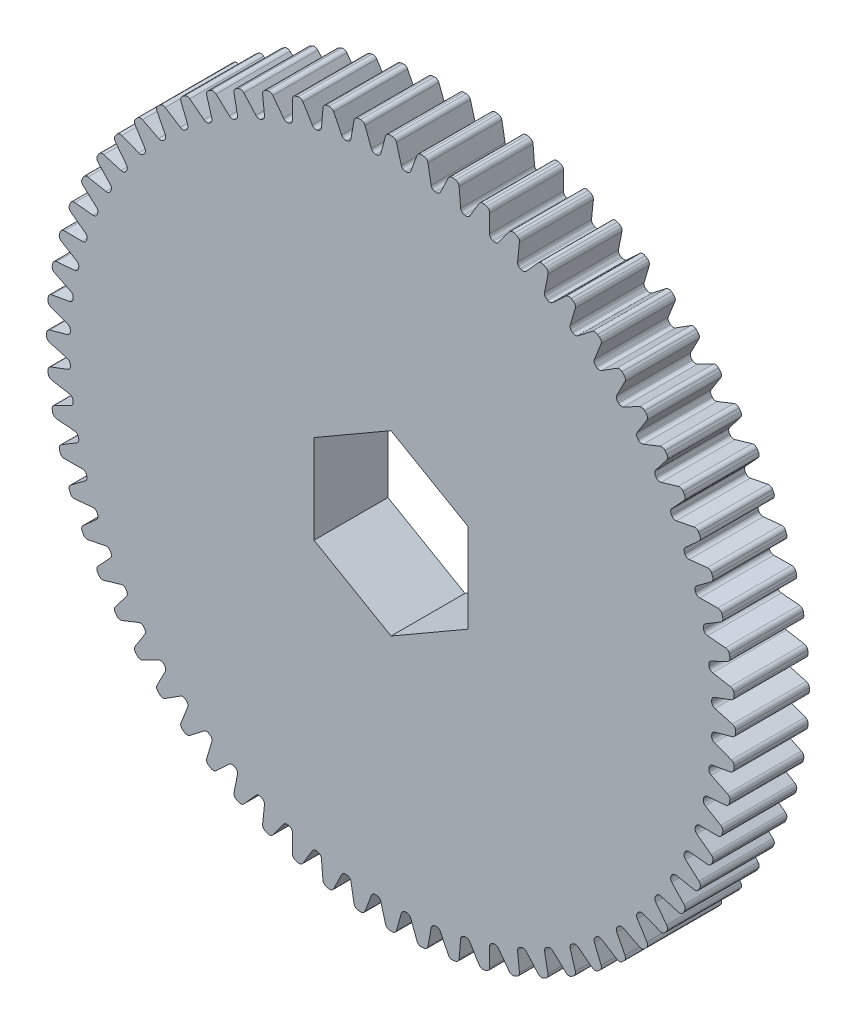
from build123d import *

# Parameters (mm, degrees)
SKETCH2_R           = 26.05
BOSS_EXTRUDE1_DEPTH = 6
BOSS_EXTRUDE2_DEPTH = 6
FILLET1_R           = 0.35
CIRPATTERN2_DEPTH   = 6
CUT_EXTRUDE1_DEPTH  = 40.980057529


# Read off the part's stored shape, not the designer's step: CirPattern2
with BuildPart() as part:
    # Sketch2 → Boss-Extrude1 (new body)
    with BuildSketch(Plane.XY):
        Circle(SKETCH2_R)
    extrude(amount=BOSS_EXTRUDE1_DEPTH)

    # Sketch3 → Boss-Extrude2 (add)
    with BuildSketch(Plane.XY):
        with BuildLine():
            Line((-0.375, 27.947484234), (-0.9, 26.034448333))
            ThreePointArc((-0.9, 26.034448333), (0, 26.05), (0.9, 26.034448333))
            Line((0.9, 26.034448333), (0.375, 27.947484234))
            ThreePointArc((0.375, 27.947484234), (0, 27.95), (-0.375, 27.947484234))
        make_face()
    extrude(amount=BOSS_EXTRUDE2_DEPTH)

    # Fillet1
    fillet1_edges = [part.edges().sort_by_distance(p)[0] for p in [
        (0.375, 27.947484234, 3),
        (-0.375, 27.947484234, 3),
        (-0.9, 26.034448333, 3),
        (0.9, 26.034448333, 3),
    ]]
    fillet(fillet1_edges, radius=FILLET1_R)

    # CirPattern2 outline → CirPattern2 (add)
    with BuildSketch(Plane.XY):
        with BuildLine():
            ThreePointArc((-3.253611534, 26.092546808), (-3.355588666, 25.901404355), (-3.550535103, 25.806902187))
            ThreePointArc((-3.550535103, 25.806902187), (-2.403590764, 25.938875293), (-1.251925338, 26.019899749))
            ThreePointArc((-1.251925338, 26.019899749), (-1.460917168, 26.076971525), (-1.59628028, 26.246121165))
            Line((-1.59628028, 26.246121165), (-2.112033528, 27.615345868))
            ThreePointArc((-2.112033528, 27.615345868), (-2.253348658, 27.788320087), (-2.470504527, 27.840601778))
            ThreePointArc((-2.470504527, 27.840601778), (-2.578900647, 27.830770227), (-2.687257659, 27.820516643))
            ThreePointArc((-2.687257659, 27.820516643), (-2.891109301, 27.729222861), (-2.998234344, 27.533227269))
            Line((-2.998234344, 27.533227269), (-3.253611534, 26.092546808))
        make_face()
        with BuildLine():
            ThreePointArc((-5.647248689, 25.681035205), (-5.731154404, 25.481298869), (-5.916549674, 25.369212443))
            ThreePointArc((-5.916549674, 25.369212443), (-4.786674939, 25.606449247), (-3.647398308, 25.793390347))
            ThreePointArc((-3.647398308, 25.793390347), (-3.860764536, 25.830935331), (-4.011157372, 25.986873677))
            Line((-4.011157372, 25.986873677), (-4.651046625, 27.302669803))
            ThreePointArc((-4.651046625, 27.302669803), (-4.807718977, 27.461867229), (-5.028772443, 27.49388928))
            ThreePointArc((-5.028772443, 27.49388928), (-5.135799023, 27.474098136), (-5.242747722, 27.453890368))
            ThreePointArc((-5.242747722, 27.453890368), (-5.437306241, 27.344176973), (-5.525890116, 27.139133212))
            Line((-5.525890116, 27.139133212), (-5.647248689, 25.681035205))
        make_face()
        with BuildLine():
            ThreePointArc((-7.992705509, 25.050422064), (-8.057823954, 24.843795926), (-8.232086329, 24.715081523))
            ThreePointArc((-8.232086329, 24.715081523), (-7.128920891, 25.055558005), (-6.011752962, 25.346820833))
            ThreePointArc((-6.011752962, 25.346820833), (-6.227673221, 25.364518705), (-6.391812684, 25.505915345))
            Line((-6.391812684, 25.505915345), (-7.150378632, 26.757056985))
            ThreePointArc((-7.150378632, 26.757056985), (-7.321071533, 26.901119402), (-7.544136646, 26.912608611))
            ThreePointArc((-7.544136646, 26.912608611), (-7.648880573, 26.883026727), (-7.75350851, 26.85303718))
            ThreePointArc((-7.75350851, 26.85303718), (-7.937114002, 26.725840207), (-8.006400941, 26.513497638))
            Line((-8.006400941, 26.513497638), (-7.992705509, 25.050422064))
        make_face()
        with BuildLine():
            ThreePointArc((-10.269971384, 24.206087555), (-10.31574699, 23.994334475), (-10.477389726, 23.850090242))
            ThreePointArc((-10.477389726, 23.850090242), (-9.410345404, 24.290901576), (-8.32481746, 24.68400118))
            ThreePointArc((-8.32481746, 24.68400118), (-8.541449595, 24.681700948), (-8.717935303, 24.807349536))
            Line((-8.717935303, 24.807349536), (-9.588706129, 25.983162391))
            ThreePointArc((-9.588706129, 25.983162391), (-9.771963287, 26.110860709), (-9.995136934, 26.101719056))
            ThreePointArc((-9.995136934, 26.101719056), (-10.09670457, 26.062598812), (-10.198119096, 26.023083347))
            ThreePointArc((-10.198119096, 26.023083347), (-10.369205104, 25.879487997), (-10.418603977, 25.661658252))
            Line((-10.418603977, 25.661658252), (-10.269971384, 24.206087555))
        make_face()
        with BuildLine():
            ThreePointArc((-12.459617484, 23.155235242), (-12.485659711, 22.940161823), (-12.633303728, 22.7816184))
            ThreePointArc((-12.633303728, 22.7816184), (-11.611484168, 23.31900374), (-10.56685755, 23.810586333))
            ThreePointArc((-10.56685755, 23.810586333), (-10.782353332, 23.788307622), (-10.969679572, 23.897136168))
            Line((-10.969679572, 23.897136168), (-11.945226166, 24.987588617))
            ThreePointArc((-11.945226166, 24.987588617), (-12.139484096, 25.09783336), (-12.360862239, 25.068138836))
            ThreePointArc((-12.360862239, 25.068138836), (-12.458387044, 25.019813993), (-12.555722927, 24.971109743))
            ThreePointArc((-12.555722927, 24.971109743), (-12.712829804, 24.81234112), (-12.741919157, 24.590882645))
            Line((-12.741919157, 24.590882645), (-12.459617484, 23.155235242))
        make_face()
        with BuildLine():
            ThreePointArc((-14.542962521, 21.906830625), (-14.549049185, 21.690271798), (-14.681434837, 21.518781822))
            ThreePointArc((-14.681434837, 21.518781822), (-13.713557843, 22.148156386), (-12.718744937, 22.734027959))
            ThreePointArc((-12.718744937, 22.734027959), (-12.931265832, 22.691960842), (-13.127834403, 22.78304086))
            Line((-13.127834403, 22.78304086), (-14.199833746, 23.778829547))
            ThreePointArc((-14.199833746, 23.778829547), (-14.403435107, 23.870680145), (-14.621129025, 23.820686095))
            ThreePointArc((-14.621129025, 23.820686095), (-14.713778952, 23.763568944), (-14.806205756, 23.706091435))
            ThreePointArc((-14.806205756, 23.706091435), (-14.947993123, 23.533504097), (-14.956524776, 23.310306298))
            Line((-14.956524776, 23.310306298), (-14.542962521, 21.906830625))
        make_face()
        with BuildLine():
            ThreePointArc((-16.50223213, 20.471524654), (-16.488311301, 20.255328023), (-16.604309121, 20.072354586))
            ThreePointArc((-16.604309121, 20.072354586), (-15.698632278, 20.788348771), (-14.762120477, 21.463510873))
            ThreePointArc((-14.762120477, 21.463510873), (-14.969853331, 21.402014254), (-15.17398718, 21.47456868))
            Line((-15.17398718, 21.47456868), (-16.333293351, 22.367197888))
            ThreePointArc((-16.333293351, 22.367197888), (-16.544501089, 22.439870704), (-16.756653493, 22.370003659))
            ThreePointArc((-16.756653493, 22.370003659), (-16.843638087, 22.304581502), (-16.930367259, 22.238821113))
            ThreePointArc((-16.930367259, 22.238821113), (-17.055625435, 22.053887514), (-17.043526598, 21.830854636))
            Line((-17.043526598, 21.830854636), (-16.50223213, 20.471524654))
        make_face()
        with BuildLine():
            ThreePointArc((-18.320710513, 18.861562853), (-18.286900959, 18.64757293), (-18.385521294, 18.454677097))
            ThreePointArc((-18.385521294, 18.454677097), (-17.549771517, 19.251182294), (-16.67955081, 20.009874681))
            ThreePointArc((-16.67955081, 20.009874681), (-16.88072332, 19.929473225), (-17.090680848, 19.982883053))
            Line((-17.090680848, 19.982883053), (-18.327403056, 20.764737183))
            ThreePointArc((-18.327403056, 20.764737183), (-18.54441522, 20.817612198), (-18.749216102, 20.728468239))
            ThreePointArc((-18.749216102, 20.728468239), (-18.82979324, 20.655299236), (-18.910084837, 20.58181701))
            ThreePointArc((-18.910084837, 20.58181701), (-19.017745164, 20.386114939), (-18.985119062, 20.16514982))
            Line((-18.985119062, 20.16514982), (-18.320710513, 18.861562853))
        make_face()
        with BuildLine():
            ThreePointArc((-19.982883053, 17.090680848), (-19.929473225, 16.88072332), (-20.009874681, 16.67955081))
            ThreePointArc((-20.009874681, 16.67955081), (-19.251182294, 17.549771517), (-18.454677097, 18.385521294))
            ThreePointArc((-18.454677097, 18.385521294), (-18.64757293, 18.286900959), (-18.861562853, 18.320710513))
            Line((-18.861562853, 18.320710513), (-20.16514982, 18.985119062))
            ThreePointArc((-20.16514982, 18.985119062), (-20.386114939, 19.017745164), (-20.58181701, 18.910084837))
            ThreePointArc((-20.58181701, 18.910084837), (-20.655299236, 18.82979324), (-20.728468239, 18.749216102))
            ThreePointArc((-20.728468239, 18.749216102), (-20.817612198, 18.54441522), (-20.764737183, 18.327403056))
            Line((-20.764737183, 18.327403056), (-19.982883053, 17.090680848))
        make_face()
        with BuildLine():
            ThreePointArc((-21.47456868, 15.17398718), (-21.402014254, 14.969853331), (-21.463510873, 14.762120477))
            ThreePointArc((-21.463510873, 14.762120477), (-20.788348771, 15.698632278), (-20.072354586, 16.604309121))
            ThreePointArc((-20.072354586, 16.604309121), (-20.255328023, 16.488311301), (-20.471524654, 16.50223213))
            Line((-20.471524654, 16.50223213), (-21.830854636, 17.043526598))
            ThreePointArc((-21.830854636, 17.043526598), (-22.053887514, 17.055625435), (-22.238821113, 16.930367259))
            ThreePointArc((-22.238821113, 16.930367259), (-22.304581502, 16.843638087), (-22.370003659, 16.756653493))
            ThreePointArc((-22.370003659, 16.756653493), (-22.439870704, 16.544501089), (-22.367197888, 16.333293351))
            Line((-22.367197888, 16.333293351), (-21.47456868, 15.17398718))
        make_face()
        with BuildLine():
            ThreePointArc((-22.78304086, 13.127834403), (-22.691960842, 12.931265832), (-22.734027959, 12.718744937))
            ThreePointArc((-22.734027959, 12.718744937), (-22.148156386, 13.713557843), (-21.518781822, 14.681434837))
            ThreePointArc((-21.518781822, 14.681434837), (-21.690271798, 14.549049185), (-21.906830625, 14.542962521))
            Line((-21.906830625, 14.542962521), (-23.310306298, 14.956524776))
            ThreePointArc((-23.310306298, 14.956524776), (-23.533504097, 14.947993123), (-23.706091435, 14.806205756))
            ThreePointArc((-23.706091435, 14.806205756), (-23.763568944, 14.713778952), (-23.820686095, 14.621129025))
            ThreePointArc((-23.820686095, 14.621129025), (-23.870680145, 14.403435107), (-23.778829547, 14.199833746))
            Line((-23.778829547, 14.199833746), (-22.78304086, 13.127834403))
        make_face()
        with BuildLine():
            ThreePointArc((-23.897136168, 10.969679572), (-23.788307622, 10.782353332), (-23.810586333, 10.56685755))
            ThreePointArc((-23.810586333, 10.56685755), (-23.31900374, 11.611484168), (-22.7816184, 12.633303728))
            ThreePointArc((-22.7816184, 12.633303728), (-22.940161823, 12.485659711), (-23.155235242, 12.459617484))
            Line((-23.155235242, 12.459617484), (-24.590882645, 12.741919157))
            ThreePointArc((-24.590882645, 12.741919157), (-24.81234112, 12.712829804), (-24.971109743, 12.555722927))
            ThreePointArc((-24.971109743, 12.555722927), (-25.019813993, 12.458387044), (-25.068138836, 12.360862239))
            ThreePointArc((-25.068138836, 12.360862239), (-25.09783336, 12.139484096), (-24.987588617, 11.945226166))
            Line((-24.987588617, 11.945226166), (-23.897136168, 10.969679572))
        make_face()
        with BuildLine():
            ThreePointArc((-24.807349536, 8.717935303), (-24.681700948, 8.541449595), (-24.68400118, 8.32481746))
            ThreePointArc((-24.68400118, 8.32481746), (-24.290901576, 9.410345404), (-23.850090242, 10.477389726))
            ThreePointArc((-23.850090242, 10.477389726), (-23.994334475, 10.31574699), (-24.206087555, 10.269971384))
            Line((-24.206087555, 10.269971384), (-25.661658252, 10.418603977))
            ThreePointArc((-25.661658252, 10.418603977), (-25.879487997, 10.369205104), (-26.023083347, 10.198119096))
            ThreePointArc((-26.023083347, 10.198119096), (-26.062598812, 10.09670457), (-26.101719056, 9.995136934))
            ThreePointArc((-26.101719056, 9.995136934), (-26.110860709, 9.771963287), (-25.983162391, 9.588706129))
            Line((-25.983162391, 9.588706129), (-24.807349536, 8.717935303))
        make_face()
        with BuildLine():
            ThreePointArc((-25.505915345, 6.391812684), (-25.364518705, 6.227673221), (-25.346820833, 6.011752962))
            ThreePointArc((-25.346820833, 6.011752962), (-25.055558005, 7.128920891), (-24.715081523, 8.232086329))
            ThreePointArc((-24.715081523, 8.232086329), (-24.843795926, 8.057823954), (-25.050422064, 7.992705509))
            Line((-25.050422064, 7.992705509), (-26.513497638, 8.006400941))
            ThreePointArc((-26.513497638, 8.006400941), (-26.725840207, 7.937114002), (-26.85303718, 7.75350851))
            ThreePointArc((-26.85303718, 7.75350851), (-26.883026727, 7.648880573), (-26.912608611, 7.544136646))
            ThreePointArc((-26.912608611, 7.544136646), (-26.901119402, 7.321071533), (-26.757056985, 7.150378632))
            Line((-26.757056985, 7.150378632), (-25.505915345, 6.391812684))
        make_face()
        with BuildLine():
            ThreePointArc((-25.986873677, 4.011157372), (-25.830935331, 3.860764536), (-25.793390347, 3.647398308))
            ThreePointArc((-25.793390347, 3.647398308), (-25.606449247, 4.786674939), (-25.369212443, 5.916549674))
            ThreePointArc((-25.369212443, 5.916549674), (-25.481298869, 5.731154404), (-25.681035205, 5.647248689))
            Line((-25.681035205, 5.647248689), (-27.139133212, 5.525890116))
            ThreePointArc((-27.139133212, 5.525890116), (-27.344176973, 5.437306241), (-27.453890368, 5.242747722))
            ThreePointArc((-27.453890368, 5.242747722), (-27.474098136, 5.135799023), (-27.49388928, 5.028772443))
            ThreePointArc((-27.49388928, 5.028772443), (-27.461867229, 4.807718977), (-27.302669803, 4.651046625))
            Line((-27.302669803, 4.651046625), (-25.986873677, 4.011157372))
        make_face()
        with BuildLine():
            ThreePointArc((-26.246121165, 1.59628028), (-26.076971525, 1.460917168), (-26.019899749, 1.251925338))
            ThreePointArc((-26.019899749, 1.251925338), (-25.938875293, 2.403590764), (-25.806902187, 3.550535103))
            ThreePointArc((-25.806902187, 3.550535103), (-25.901404355, 3.355588666), (-26.092546808, 3.253611534))
            Line((-26.092546808, 3.253611534), (-27.533227269, 2.998234344))
            ThreePointArc((-27.533227269, 2.998234344), (-27.729222861, 2.891109301), (-27.820516643, 2.687257659))
            ThreePointArc((-27.820516643, 2.687257659), (-27.830770227, 2.578900647), (-27.840601778, 2.470504527))
            ThreePointArc((-27.840601778, 2.470504527), (-27.788320087, 2.253348658), (-27.615345868, 2.112033528))
            Line((-27.615345868, 2.112033528), (-26.246121165, 1.59628028))
        make_face()
        with BuildLine():
            ThreePointArc((-26.281446002, -0.832215712), (-26.100528192, -0.951394229), (-26.024416541, -1.154228619))
            ThreePointArc((-26.024416541, -1.154228619), (-26.05, 0), (-26.024416541, 1.154228619))
            ThreePointArc((-26.024416541, 1.154228619), (-26.100528192, 0.951394229), (-26.281446002, 0.832215712))
            Line((-26.281446002, 0.832215712), (-27.69241754, 0.444998694))
            ThreePointArc((-27.69241754, 0.444998694), (-27.877692797, 0.320246436), (-27.949788079, 0.108840862))
            ThreePointArc((-27.949788079, 0.108840862), (-27.95, 0), (-27.949788079, -0.108840862))
            ThreePointArc((-27.949788079, -0.108840862), (-27.877692797, -0.320246436), (-27.69241754, -0.444998694))
            Line((-27.69241754, -0.444998694), (-26.281446002, -0.832215712))
        make_face()
        with BuildLine():
            ThreePointArc((-26.092546808, -3.253611534), (-25.901404355, -3.355588666), (-25.806902187, -3.550535103))
            ThreePointArc((-25.806902187, -3.550535103), (-25.938875292, -2.403590764), (-26.019899749, -1.251925338))
            ThreePointArc((-26.019899749, -1.251925338), (-26.076971525, -1.460917168), (-26.246121165, -1.59628028))
            Line((-26.246121165, -1.59628028), (-27.615345868, -2.112033528))
            ThreePointArc((-27.615345868, -2.112033528), (-27.788320087, -2.253348658), (-27.840601778, -2.470504527))
            ThreePointArc((-27.840601778, -2.470504527), (-27.830770227, -2.578900647), (-27.820516643, -2.687257659))
            ThreePointArc((-27.820516643, -2.687257659), (-27.729222861, -2.891109301), (-27.533227269, -2.998234344))
            Line((-27.533227269, -2.998234344), (-26.092546808, -3.253611534))
        make_face()
        with BuildLine():
            ThreePointArc((-25.681035205, -5.647248689), (-25.481298869, -5.731154404), (-25.369212443, -5.916549674))
            ThreePointArc((-25.369212443, -5.916549674), (-25.606449247, -4.786674939), (-25.793390347, -3.647398308))
            ThreePointArc((-25.793390347, -3.647398308), (-25.830935331, -3.860764536), (-25.986873677, -4.011157372))
            Line((-25.986873677, -4.011157372), (-27.302669803, -4.651046625))
            ThreePointArc((-27.302669803, -4.651046625), (-27.461867229, -4.807718977), (-27.49388928, -5.028772443))
            ThreePointArc((-27.49388928, -5.028772443), (-27.474098136, -5.135799023), (-27.453890368, -5.242747722))
            ThreePointArc((-27.453890368, -5.242747722), (-27.344176973, -5.437306241), (-27.139133212, -5.525890116))
            Line((-27.139133212, -5.525890116), (-25.681035205, -5.647248689))
        make_face()
        with BuildLine():
            ThreePointArc((-25.050422064, -7.992705509), (-24.843795926, -8.057823954), (-24.715081523, -8.232086329))
            ThreePointArc((-24.715081523, -8.232086329), (-25.055558005, -7.128920891), (-25.346820833, -6.011752962))
            ThreePointArc((-25.346820833, -6.011752962), (-25.364518705, -6.227673221), (-25.505915345, -6.391812684))
            Line((-25.505915345, -6.391812684), (-26.757056985, -7.150378632))
            ThreePointArc((-26.757056985, -7.150378632), (-26.901119402, -7.321071533), (-26.912608611, -7.544136646))
            ThreePointArc((-26.912608611, -7.544136646), (-26.883026727, -7.648880573), (-26.85303718, -7.75350851))
            ThreePointArc((-26.85303718, -7.75350851), (-26.725840207, -7.937114002), (-26.513497638, -8.006400941))
            Line((-26.513497638, -8.006400941), (-25.050422064, -7.992705509))
        make_face()
        with BuildLine():
            ThreePointArc((-24.206087555, -10.269971384), (-23.994334475, -10.31574699), (-23.850090242, -10.477389726))
            ThreePointArc((-23.850090242, -10.477389726), (-24.290901576, -9.410345404), (-24.68400118, -8.32481746))
            ThreePointArc((-24.68400118, -8.32481746), (-24.681700948, -8.541449595), (-24.807349536, -8.717935303))
            Line((-24.807349536, -8.717935303), (-25.983162391, -9.588706129))
            ThreePointArc((-25.983162391, -9.588706129), (-26.110860709, -9.771963287), (-26.101719056, -9.995136934))
            ThreePointArc((-26.101719056, -9.995136934), (-26.062598812, -10.09670457), (-26.023083347, -10.198119096))
            ThreePointArc((-26.023083347, -10.198119096), (-25.879487997, -10.369205104), (-25.661658252, -10.418603977))
            Line((-25.661658252, -10.418603977), (-24.206087555, -10.269971384))
        make_face()
        with BuildLine():
            ThreePointArc((-23.155235242, -12.459617484), (-22.940161823, -12.485659711), (-22.7816184, -12.633303728))
            ThreePointArc((-22.7816184, -12.633303728), (-23.31900374, -11.611484168), (-23.810586333, -10.56685755))
            ThreePointArc((-23.810586333, -10.56685755), (-23.788307622, -10.782353332), (-23.897136168, -10.969679572))
            Line((-23.897136168, -10.969679572), (-24.987588617, -11.945226166))
            ThreePointArc((-24.987588617, -11.945226166), (-25.09783336, -12.139484096), (-25.068138836, -12.360862239))
            ThreePointArc((-25.068138836, -12.360862239), (-25.019813993, -12.458387044), (-24.971109743, -12.555722927))
            ThreePointArc((-24.971109743, -12.555722927), (-24.81234112, -12.712829804), (-24.590882645, -12.741919157))
            Line((-24.590882645, -12.741919157), (-23.155235242, -12.459617484))
        make_face()
        with BuildLine():
            ThreePointArc((-21.906830625, -14.542962521), (-21.690271798, -14.549049185), (-21.518781822, -14.681434837))
            ThreePointArc((-21.518781822, -14.681434837), (-22.148156386, -13.713557843), (-22.734027959, -12.718744937))
            ThreePointArc((-22.734027959, -12.718744937), (-22.691960842, -12.931265832), (-22.78304086, -13.127834403))
            Line((-22.78304086, -13.127834403), (-23.778829547, -14.199833746))
            ThreePointArc((-23.778829547, -14.199833746), (-23.870680145, -14.403435107), (-23.820686095, -14.621129025))
            ThreePointArc((-23.820686095, -14.621129025), (-23.763568944, -14.713778952), (-23.706091435, -14.806205756))
            ThreePointArc((-23.706091435, -14.806205756), (-23.533504097, -14.947993123), (-23.310306298, -14.956524776))
            Line((-23.310306298, -14.956524776), (-21.906830625, -14.542962521))
        make_face()
        with BuildLine():
            ThreePointArc((-20.471524654, -16.50223213), (-20.255328023, -16.488311301), (-20.072354586, -16.604309121))
            ThreePointArc((-20.072354586, -16.604309121), (-20.788348771, -15.698632278), (-21.463510873, -14.762120477))
            ThreePointArc((-21.463510873, -14.762120477), (-21.402014254, -14.969853331), (-21.47456868, -15.17398718))
            Line((-21.47456868, -15.17398718), (-22.367197888, -16.333293351))
            ThreePointArc((-22.367197888, -16.333293351), (-22.439870704, -16.544501089), (-22.370003659, -16.756653493))
            ThreePointArc((-22.370003659, -16.756653493), (-22.304581502, -16.843638087), (-22.238821113, -16.930367259))
            ThreePointArc((-22.238821113, -16.930367259), (-22.053887514, -17.055625435), (-21.830854636, -17.043526598))
            Line((-21.830854636, -17.043526598), (-20.471524654, -16.50223213))
        make_face()
        with BuildLine():
            ThreePointArc((-18.861562853, -18.320710513), (-18.64757293, -18.286900959), (-18.454677097, -18.385521294))
            ThreePointArc((-18.454677097, -18.385521294), (-19.251182294, -17.549771517), (-20.009874681, -16.67955081))
            ThreePointArc((-20.009874681, -16.67955081), (-19.929473225, -16.88072332), (-19.982883053, -17.090680848))
            Line((-19.982883053, -17.090680848), (-20.764737183, -18.327403056))
            ThreePointArc((-20.764737183, -18.327403056), (-20.817612198, -18.54441522), (-20.728468239, -18.749216102))
            ThreePointArc((-20.728468239, -18.749216102), (-20.655299236, -18.82979324), (-20.58181701, -18.910084837))
            ThreePointArc((-20.58181701, -18.910084837), (-20.386114939, -19.017745164), (-20.16514982, -18.985119062))
            Line((-20.16514982, -18.985119062), (-18.861562853, -18.320710513))
        make_face()
        with BuildLine():
            ThreePointArc((-17.090680848, -19.982883053), (-16.88072332, -19.929473225), (-16.67955081, -20.009874681))
            ThreePointArc((-16.67955081, -20.009874681), (-17.549771517, -19.251182294), (-18.385521294, -18.454677097))
            ThreePointArc((-18.385521294, -18.454677097), (-18.286900959, -18.64757293), (-18.320710513, -18.861562853))
            Line((-18.320710513, -18.861562853), (-18.985119062, -20.16514982))
            ThreePointArc((-18.985119062, -20.16514982), (-19.017745164, -20.386114939), (-18.910084837, -20.58181701))
            ThreePointArc((-18.910084837, -20.58181701), (-18.82979324, -20.655299236), (-18.749216102, -20.728468239))
            ThreePointArc((-18.749216102, -20.728468239), (-18.54441522, -20.817612198), (-18.327403056, -20.764737183))
            Line((-18.327403056, -20.764737183), (-17.090680848, -19.982883053))
        make_face()
        with BuildLine():
            ThreePointArc((-15.17398718, -21.47456868), (-14.969853331, -21.402014254), (-14.762120477, -21.463510873))
            ThreePointArc((-14.762120477, -21.463510873), (-15.698632278, -20.788348771), (-16.604309121, -20.072354586))
            ThreePointArc((-16.604309121, -20.072354586), (-16.488311301, -20.255328023), (-16.50223213, -20.471524654))
            Line((-16.50223213, -20.471524654), (-17.043526598, -21.830854636))
            ThreePointArc((-17.043526598, -21.830854636), (-17.055625435, -22.053887514), (-16.930367259, -22.238821113))
            ThreePointArc((-16.930367259, -22.238821113), (-16.843638087, -22.304581502), (-16.756653493, -22.370003659))
            ThreePointArc((-16.756653493, -22.370003659), (-16.544501089, -22.439870704), (-16.333293351, -22.367197888))
            Line((-16.333293351, -22.367197888), (-15.17398718, -21.47456868))
        make_face()
        with BuildLine():
            ThreePointArc((-13.127834403, -22.78304086), (-12.931265832, -22.691960842), (-12.718744937, -22.734027959))
            ThreePointArc((-12.718744937, -22.734027959), (-13.713557843, -22.148156386), (-14.681434837, -21.518781822))
            ThreePointArc((-14.681434837, -21.518781822), (-14.549049185, -21.690271798), (-14.542962521, -21.906830625))
            Line((-14.542962521, -21.906830625), (-14.956524776, -23.310306298))
            ThreePointArc((-14.956524776, -23.310306298), (-14.947993123, -23.533504097), (-14.806205756, -23.706091435))
            ThreePointArc((-14.806205756, -23.706091435), (-14.713778952, -23.763568944), (-14.621129025, -23.820686095))
            ThreePointArc((-14.621129025, -23.820686095), (-14.403435107, -23.870680145), (-14.199833746, -23.778829547))
            Line((-14.199833746, -23.778829547), (-13.127834403, -22.78304086))
        make_face()
        with BuildLine():
            ThreePointArc((-10.969679572, -23.897136168), (-10.782353332, -23.788307622), (-10.56685755, -23.810586333))
            ThreePointArc((-10.56685755, -23.810586333), (-11.611484168, -23.31900374), (-12.633303728, -22.7816184))
            ThreePointArc((-12.633303728, -22.7816184), (-12.485659711, -22.940161823), (-12.459617484, -23.155235242))
            Line((-12.459617484, -23.155235242), (-12.741919157, -24.590882645))
            ThreePointArc((-12.741919157, -24.590882645), (-12.712829804, -24.81234112), (-12.555722927, -24.971109743))
            ThreePointArc((-12.555722927, -24.971109743), (-12.458387044, -25.019813993), (-12.360862239, -25.068138836))
            ThreePointArc((-12.360862239, -25.068138836), (-12.139484096, -25.09783336), (-11.945226166, -24.987588617))
            Line((-11.945226166, -24.987588617), (-10.969679572, -23.897136168))
        make_face()
        with BuildLine():
            ThreePointArc((-8.717935303, -24.807349536), (-8.541449595, -24.681700948), (-8.32481746, -24.68400118))
            ThreePointArc((-8.32481746, -24.68400118), (-9.410345404, -24.290901576), (-10.477389726, -23.850090242))
            ThreePointArc((-10.477389726, -23.850090242), (-10.31574699, -23.994334475), (-10.269971384, -24.206087555))
            Line((-10.269971384, -24.206087555), (-10.418603977, -25.661658252))
            ThreePointArc((-10.418603977, -25.661658252), (-10.369205104, -25.879487997), (-10.198119096, -26.023083347))
            ThreePointArc((-10.198119096, -26.023083347), (-10.09670457, -26.062598812), (-9.995136934, -26.101719056))
            ThreePointArc((-9.995136934, -26.101719056), (-9.771963287, -26.110860709), (-9.588706129, -25.983162391))
            Line((-9.588706129, -25.983162391), (-8.717935303, -24.807349536))
        make_face()
        with BuildLine():
            ThreePointArc((-6.391812684, -25.505915345), (-6.227673221, -25.364518705), (-6.011752962, -25.346820833))
            ThreePointArc((-6.011752962, -25.346820833), (-7.128920891, -25.055558005), (-8.232086329, -24.715081523))
            ThreePointArc((-8.232086329, -24.715081523), (-8.057823954, -24.843795926), (-7.992705509, -25.050422064))
            Line((-7.992705509, -25.050422064), (-8.006400941, -26.513497638))
            ThreePointArc((-8.006400941, -26.513497638), (-7.937114002, -26.725840207), (-7.75350851, -26.85303718))
            ThreePointArc((-7.75350851, -26.85303718), (-7.648880573, -26.883026727), (-7.544136646, -26.912608611))
            ThreePointArc((-7.544136646, -26.912608611), (-7.321071533, -26.901119402), (-7.150378632, -26.757056985))
            Line((-7.150378632, -26.757056985), (-6.391812684, -25.505915345))
        make_face()
        with BuildLine():
            ThreePointArc((-4.011157372, -25.986873677), (-3.860764536, -25.830935331), (-3.647398308, -25.793390347))
            ThreePointArc((-3.647398308, -25.793390347), (-4.786674939, -25.606449247), (-5.916549674, -25.369212443))
            ThreePointArc((-5.916549674, -25.369212443), (-5.731154404, -25.481298869), (-5.647248689, -25.681035205))
            Line((-5.647248689, -25.681035205), (-5.525890116, -27.139133212))
            ThreePointArc((-5.525890116, -27.139133212), (-5.437306241, -27.344176973), (-5.242747722, -27.453890368))
            ThreePointArc((-5.242747722, -27.453890368), (-5.135799023, -27.474098136), (-5.028772443, -27.49388928))
            ThreePointArc((-5.028772443, -27.49388928), (-4.807718977, -27.461867229), (-4.651046625, -27.302669803))
            Line((-4.651046625, -27.302669803), (-4.011157372, -25.986873677))
        make_face()
        with BuildLine():
            ThreePointArc((-1.59628028, -26.246121165), (-1.460917168, -26.076971525), (-1.251925338, -26.019899749))
            ThreePointArc((-1.251925338, -26.019899749), (-2.403590764, -25.938875292), (-3.550535103, -25.806902187))
            ThreePointArc((-3.550535103, -25.806902187), (-3.355588666, -25.901404355), (-3.253611534, -26.092546808))
            Line((-3.253611534, -26.092546808), (-2.998234344, -27.533227269))
            ThreePointArc((-2.998234344, -27.533227269), (-2.891109301, -27.729222861), (-2.687257659, -27.820516643))
            ThreePointArc((-2.687257659, -27.820516643), (-2.578900647, -27.830770227), (-2.470504527, -27.840601778))
            ThreePointArc((-2.470504527, -27.840601778), (-2.253348658, -27.788320087), (-2.112033528, -27.615345868))
            Line((-2.112033528, -27.615345868), (-1.59628028, -26.246121165))
        make_face()
        with BuildLine():
            ThreePointArc((0.832215712, -26.281446002), (0.951394229, -26.100528192), (1.154228619, -26.024416541))
            ThreePointArc((1.154228619, -26.024416541), (0, -26.05), (-1.154228619, -26.024416541))
            ThreePointArc((-1.154228619, -26.024416541), (-0.951394229, -26.100528192), (-0.832215712, -26.281446002))
            Line((-0.832215712, -26.281446002), (-0.444998694, -27.69241754))
            ThreePointArc((-0.444998694, -27.69241754), (-0.320246436, -27.877692797), (-0.108840862, -27.949788079))
            ThreePointArc((-0.108840862, -27.949788079), (0, -27.95), (0.108840862, -27.949788079))
            ThreePointArc((0.108840862, -27.949788079), (0.320246436, -27.877692797), (0.444998694, -27.69241754))
            Line((0.444998694, -27.69241754), (0.832215712, -26.281446002))
        make_face()
        with BuildLine():
            ThreePointArc((3.253611534, -26.092546808), (3.355588666, -25.901404355), (3.550535103, -25.806902187))
            ThreePointArc((3.550535103, -25.806902187), (2.403590764, -25.938875292), (1.251925338, -26.019899749))
            ThreePointArc((1.251925338, -26.019899749), (1.460917168, -26.076971525), (1.59628028, -26.246121165))
            Line((1.59628028, -26.246121165), (2.112033528, -27.615345868))
            ThreePointArc((2.112033528, -27.615345868), (2.253348658, -27.788320087), (2.470504527, -27.840601778))
            ThreePointArc((2.470504527, -27.840601778), (2.578900647, -27.830770227), (2.687257659, -27.820516643))
            ThreePointArc((2.687257659, -27.820516643), (2.891109301, -27.729222861), (2.998234344, -27.533227269))
            Line((2.998234344, -27.533227269), (3.253611534, -26.092546808))
        make_face()
        with BuildLine():
            ThreePointArc((5.647248689, -25.681035205), (5.731154404, -25.481298869), (5.916549674, -25.369212443))
            ThreePointArc((5.916549674, -25.369212443), (4.786674939, -25.606449247), (3.647398308, -25.793390347))
            ThreePointArc((3.647398308, -25.793390347), (3.860764536, -25.830935331), (4.011157372, -25.986873677))
            Line((4.011157372, -25.986873677), (4.651046625, -27.302669803))
            ThreePointArc((4.651046625, -27.302669803), (4.807718977, -27.461867229), (5.028772443, -27.49388928))
            ThreePointArc((5.028772443, -27.49388928), (5.135799023, -27.474098136), (5.242747722, -27.453890368))
            ThreePointArc((5.242747722, -27.453890368), (5.437306241, -27.344176973), (5.525890116, -27.139133212))
            Line((5.525890116, -27.139133212), (5.647248689, -25.681035205))
        make_face()
        with BuildLine():
            ThreePointArc((7.992705509, -25.050422064), (8.057823954, -24.843795926), (8.232086329, -24.715081523))
            ThreePointArc((8.232086329, -24.715081523), (7.128920891, -25.055558005), (6.011752962, -25.346820833))
            ThreePointArc((6.011752962, -25.346820833), (6.227673221, -25.364518705), (6.391812684, -25.505915345))
            Line((6.391812684, -25.505915345), (7.150378632, -26.757056985))
            ThreePointArc((7.150378632, -26.757056985), (7.321071533, -26.901119402), (7.544136646, -26.912608611))
            ThreePointArc((7.544136646, -26.912608611), (7.648880573, -26.883026727), (7.75350851, -26.85303718))
            ThreePointArc((7.75350851, -26.85303718), (7.937114002, -26.725840207), (8.006400941, -26.513497638))
            Line((8.006400941, -26.513497638), (7.992705509, -25.050422064))
        make_face()
        with BuildLine():
            ThreePointArc((10.269971384, -24.206087555), (10.31574699, -23.994334475), (10.477389726, -23.850090242))
            ThreePointArc((10.477389726, -23.850090242), (9.410345404, -24.290901576), (8.32481746, -24.68400118))
            ThreePointArc((8.32481746, -24.68400118), (8.541449595, -24.681700948), (8.717935303, -24.807349536))
            Line((8.717935303, -24.807349536), (9.588706129, -25.983162391))
            ThreePointArc((9.588706129, -25.983162391), (9.771963287, -26.110860709), (9.995136934, -26.101719056))
            ThreePointArc((9.995136934, -26.101719056), (10.09670457, -26.062598812), (10.198119096, -26.023083347))
            ThreePointArc((10.198119096, -26.023083347), (10.369205104, -25.879487997), (10.418603977, -25.661658252))
            Line((10.418603977, -25.661658252), (10.269971384, -24.206087555))
        make_face()
        with BuildLine():
            ThreePointArc((12.459617484, -23.155235242), (12.485659711, -22.940161823), (12.633303728, -22.7816184))
            ThreePointArc((12.633303728, -22.7816184), (11.611484168, -23.31900374), (10.56685755, -23.810586333))
            ThreePointArc((10.56685755, -23.810586333), (10.782353332, -23.788307622), (10.969679572, -23.897136168))
            Line((10.969679572, -23.897136168), (11.945226166, -24.987588617))
            ThreePointArc((11.945226166, -24.987588617), (12.139484096, -25.09783336), (12.360862239, -25.068138836))
            ThreePointArc((12.360862239, -25.068138836), (12.458387044, -25.019813993), (12.555722927, -24.971109743))
            ThreePointArc((12.555722927, -24.971109743), (12.712829804, -24.81234112), (12.741919157, -24.590882645))
            Line((12.741919157, -24.590882645), (12.459617484, -23.155235242))
        make_face()
        with BuildLine():
            ThreePointArc((14.542962521, -21.906830625), (14.549049185, -21.690271798), (14.681434837, -21.518781822))
            ThreePointArc((14.681434837, -21.518781822), (13.713557843, -22.148156386), (12.718744937, -22.734027959))
            ThreePointArc((12.718744937, -22.734027959), (12.931265832, -22.691960842), (13.127834403, -22.78304086))
            Line((13.127834403, -22.78304086), (14.199833746, -23.778829547))
            ThreePointArc((14.199833746, -23.778829547), (14.403435107, -23.870680145), (14.621129025, -23.820686095))
            ThreePointArc((14.621129025, -23.820686095), (14.713778952, -23.763568944), (14.806205756, -23.706091435))
            ThreePointArc((14.806205756, -23.706091435), (14.947993123, -23.533504097), (14.956524776, -23.310306298))
            Line((14.956524776, -23.310306298), (14.542962521, -21.906830625))
        make_face()
        with BuildLine():
            ThreePointArc((16.50223213, -20.471524654), (16.488311301, -20.255328023), (16.604309121, -20.072354586))
            ThreePointArc((16.604309121, -20.072354586), (15.698632278, -20.788348771), (14.762120477, -21.463510873))
            ThreePointArc((14.762120477, -21.463510873), (14.969853331, -21.402014254), (15.17398718, -21.47456868))
            Line((15.17398718, -21.47456868), (16.333293351, -22.367197888))
            ThreePointArc((16.333293351, -22.367197888), (16.544501089, -22.439870704), (16.756653493, -22.370003659))
            ThreePointArc((16.756653493, -22.370003659), (16.843638087, -22.304581502), (16.930367259, -22.238821113))
            ThreePointArc((16.930367259, -22.238821113), (17.055625435, -22.053887514), (17.043526598, -21.830854636))
            Line((17.043526598, -21.830854636), (16.50223213, -20.471524654))
        make_face()
        with BuildLine():
            ThreePointArc((18.320710513, -18.861562853), (18.286900959, -18.64757293), (18.385521294, -18.454677097))
            ThreePointArc((18.385521294, -18.454677097), (17.549771517, -19.251182294), (16.67955081, -20.009874681))
            ThreePointArc((16.67955081, -20.009874681), (16.88072332, -19.929473225), (17.090680848, -19.982883053))
            Line((17.090680848, -19.982883053), (18.327403056, -20.764737183))
            ThreePointArc((18.327403056, -20.764737183), (18.54441522, -20.817612198), (18.749216102, -20.728468239))
            ThreePointArc((18.749216102, -20.728468239), (18.82979324, -20.655299236), (18.910084837, -20.58181701))
            ThreePointArc((18.910084837, -20.58181701), (19.017745164, -20.386114939), (18.985119062, -20.16514982))
            Line((18.985119062, -20.16514982), (18.320710513, -18.861562853))
        make_face()
        with BuildLine():
            ThreePointArc((19.982883053, -17.090680848), (19.929473225, -16.88072332), (20.009874681, -16.67955081))
            ThreePointArc((20.009874681, -16.67955081), (19.251182294, -17.549771517), (18.454677097, -18.385521294))
            ThreePointArc((18.454677097, -18.385521294), (18.64757293, -18.286900959), (18.861562853, -18.320710513))
            Line((18.861562853, -18.320710513), (20.16514982, -18.985119062))
            ThreePointArc((20.16514982, -18.985119062), (20.386114939, -19.017745164), (20.58181701, -18.910084837))
            ThreePointArc((20.58181701, -18.910084837), (20.655299236, -18.82979324), (20.728468239, -18.749216102))
            ThreePointArc((20.728468239, -18.749216102), (20.817612198, -18.54441522), (20.764737183, -18.327403056))
            Line((20.764737183, -18.327403056), (19.982883053, -17.090680848))
        make_face()
        with BuildLine():
            ThreePointArc((21.47456868, -15.17398718), (21.402014254, -14.969853331), (21.463510873, -14.762120477))
            ThreePointArc((21.463510873, -14.762120477), (20.788348771, -15.698632278), (20.072354586, -16.604309121))
            ThreePointArc((20.072354586, -16.604309121), (20.255328023, -16.488311301), (20.471524654, -16.50223213))
            Line((20.471524654, -16.50223213), (21.830854636, -17.043526598))
            ThreePointArc((21.830854636, -17.043526598), (22.053887514, -17.055625435), (22.238821113, -16.930367259))
            ThreePointArc((22.238821113, -16.930367259), (22.304581502, -16.843638087), (22.370003659, -16.756653493))
            ThreePointArc((22.370003659, -16.756653493), (22.439870704, -16.544501089), (22.367197888, -16.333293351))
            Line((22.367197888, -16.333293351), (21.47456868, -15.17398718))
        make_face()
        with BuildLine():
            ThreePointArc((22.78304086, -13.127834403), (22.691960842, -12.931265832), (22.734027959, -12.718744937))
            ThreePointArc((22.734027959, -12.718744937), (22.148156386, -13.713557843), (21.518781822, -14.681434837))
            ThreePointArc((21.518781822, -14.681434837), (21.690271798, -14.549049185), (21.906830625, -14.542962521))
            Line((21.906830625, -14.542962521), (23.310306298, -14.956524776))
            ThreePointArc((23.310306298, -14.956524776), (23.533504097, -14.947993123), (23.706091435, -14.806205756))
            ThreePointArc((23.706091435, -14.806205756), (23.763568944, -14.713778952), (23.820686095, -14.621129025))
            ThreePointArc((23.820686095, -14.621129025), (23.870680145, -14.403435107), (23.778829547, -14.199833746))
            Line((23.778829547, -14.199833746), (22.78304086, -13.127834403))
        make_face()
        with BuildLine():
            ThreePointArc((23.897136168, -10.969679572), (23.788307622, -10.782353332), (23.810586333, -10.56685755))
            ThreePointArc((23.810586333, -10.56685755), (23.31900374, -11.611484168), (22.7816184, -12.633303728))
            ThreePointArc((22.7816184, -12.633303728), (22.940161823, -12.485659711), (23.155235242, -12.459617484))
            Line((23.155235242, -12.459617484), (24.590882645, -12.741919157))
            ThreePointArc((24.590882645, -12.741919157), (24.81234112, -12.712829804), (24.971109743, -12.555722927))
            ThreePointArc((24.971109743, -12.555722927), (25.019813993, -12.458387044), (25.068138836, -12.360862239))
            ThreePointArc((25.068138836, -12.360862239), (25.09783336, -12.139484096), (24.987588617, -11.945226166))
            Line((24.987588617, -11.945226166), (23.897136168, -10.969679572))
        make_face()
        with BuildLine():
            ThreePointArc((24.807349536, -8.717935303), (24.681700948, -8.541449595), (24.68400118, -8.32481746))
            ThreePointArc((24.68400118, -8.32481746), (24.290901576, -9.410345404), (23.850090242, -10.477389726))
            ThreePointArc((23.850090242, -10.477389726), (23.994334475, -10.31574699), (24.206087555, -10.269971384))
            Line((24.206087555, -10.269971384), (25.661658252, -10.418603977))
            ThreePointArc((25.661658252, -10.418603977), (25.879487997, -10.369205104), (26.023083347, -10.198119096))
            ThreePointArc((26.023083347, -10.198119096), (26.062598812, -10.09670457), (26.101719056, -9.995136934))
            ThreePointArc((26.101719056, -9.995136934), (26.110860709, -9.771963287), (25.983162391, -9.588706129))
            Line((25.983162391, -9.588706129), (24.807349536, -8.717935303))
        make_face()
        with BuildLine():
            ThreePointArc((25.505915345, -6.391812684), (25.364518705, -6.227673221), (25.346820833, -6.011752962))
            ThreePointArc((25.346820833, -6.011752962), (25.055558005, -7.128920891), (24.715081523, -8.232086329))
            ThreePointArc((24.715081523, -8.232086329), (24.843795926, -8.057823954), (25.050422064, -7.992705509))
            Line((25.050422064, -7.992705509), (26.513497638, -8.006400941))
            ThreePointArc((26.513497638, -8.006400941), (26.725840207, -7.937114002), (26.85303718, -7.75350851))
            ThreePointArc((26.85303718, -7.75350851), (26.883026727, -7.648880573), (26.912608611, -7.544136646))
            ThreePointArc((26.912608611, -7.544136646), (26.901119402, -7.321071533), (26.757056985, -7.150378632))
            Line((26.757056985, -7.150378632), (25.505915345, -6.391812684))
        make_face()
        with BuildLine():
            ThreePointArc((25.986873677, -4.011157372), (25.830935331, -3.860764536), (25.793390347, -3.647398308))
            ThreePointArc((25.793390347, -3.647398308), (25.606449247, -4.786674939), (25.369212443, -5.916549674))
            ThreePointArc((25.369212443, -5.916549674), (25.481298869, -5.731154404), (25.681035205, -5.647248689))
            Line((25.681035205, -5.647248689), (27.139133212, -5.525890116))
            ThreePointArc((27.139133212, -5.525890116), (27.344176973, -5.437306241), (27.453890368, -5.242747722))
            ThreePointArc((27.453890368, -5.242747722), (27.474098136, -5.135799023), (27.49388928, -5.028772443))
            ThreePointArc((27.49388928, -5.028772443), (27.461867229, -4.807718977), (27.302669803, -4.651046625))
            Line((27.302669803, -4.651046625), (25.986873677, -4.011157372))
        make_face()
        with BuildLine():
            ThreePointArc((26.246121165, -1.59628028), (26.076971525, -1.460917168), (26.019899749, -1.251925338))
            ThreePointArc((26.019899749, -1.251925338), (25.938875292, -2.403590764), (25.806902187, -3.550535103))
            ThreePointArc((25.806902187, -3.550535103), (25.901404355, -3.355588666), (26.092546808, -3.253611534))
            Line((26.092546808, -3.253611534), (27.533227269, -2.998234344))
            ThreePointArc((27.533227269, -2.998234344), (27.729222861, -2.891109301), (27.820516643, -2.687257659))
            ThreePointArc((27.820516643, -2.687257659), (27.830770227, -2.578900647), (27.840601778, -2.470504527))
            ThreePointArc((27.840601778, -2.470504527), (27.788320087, -2.253348658), (27.615345868, -2.112033528))
            Line((27.615345868, -2.112033528), (26.246121165, -1.59628028))
        make_face()
        with BuildLine():
            ThreePointArc((26.281446002, 0.832215712), (26.100528192, 0.951394229), (26.024416541, 1.154228619))
            ThreePointArc((26.024416541, 1.154228619), (26.05, 0), (26.024416541, -1.154228619))
            ThreePointArc((26.024416541, -1.154228619), (26.100528192, -0.951394229), (26.281446002, -0.832215712))
            Line((26.281446002, -0.832215712), (27.69241754, -0.444998694))
            ThreePointArc((27.69241754, -0.444998694), (27.877692797, -0.320246436), (27.949788079, -0.108840862))
            ThreePointArc((27.949788079, -0.108840862), (27.95, 0), (27.949788079, 0.108840862))
            ThreePointArc((27.949788079, 0.108840862), (27.877692797, 0.320246436), (27.69241754, 0.444998694))
            Line((27.69241754, 0.444998694), (26.281446002, 0.832215712))
        make_face()
        with BuildLine():
            ThreePointArc((26.092546808, 3.253611534), (25.901404355, 3.355588666), (25.806902187, 3.550535103))
            ThreePointArc((25.806902187, 3.550535103), (25.938875293, 2.403590764), (26.019899749, 1.251925338))
            ThreePointArc((26.019899749, 1.251925338), (26.076971525, 1.460917168), (26.246121165, 1.59628028))
            Line((26.246121165, 1.59628028), (27.615345868, 2.112033528))
            ThreePointArc((27.615345868, 2.112033528), (27.788320087, 2.253348658), (27.840601778, 2.470504527))
            ThreePointArc((27.840601778, 2.470504527), (27.830770227, 2.578900647), (27.820516643, 2.687257659))
            ThreePointArc((27.820516643, 2.687257659), (27.729222861, 2.891109301), (27.533227269, 2.998234344))
            Line((27.533227269, 2.998234344), (26.092546808, 3.253611534))
        make_face()
        with BuildLine():
            ThreePointArc((25.681035205, 5.647248689), (25.481298869, 5.731154404), (25.369212443, 5.916549674))
            ThreePointArc((25.369212443, 5.916549674), (25.606449247, 4.786674939), (25.793390347, 3.647398308))
            ThreePointArc((25.793390347, 3.647398308), (25.830935331, 3.860764536), (25.986873677, 4.011157372))
            Line((25.986873677, 4.011157372), (27.302669803, 4.651046625))
            ThreePointArc((27.302669803, 4.651046625), (27.461867229, 4.807718977), (27.49388928, 5.028772443))
            ThreePointArc((27.49388928, 5.028772443), (27.474098136, 5.135799023), (27.453890368, 5.242747722))
            ThreePointArc((27.453890368, 5.242747722), (27.344176973, 5.437306241), (27.139133212, 5.525890116))
            Line((27.139133212, 5.525890116), (25.681035205, 5.647248689))
        make_face()
        with BuildLine():
            ThreePointArc((25.050422064, 7.992705509), (24.843795926, 8.057823954), (24.715081523, 8.232086329))
            ThreePointArc((24.715081523, 8.232086329), (25.055558005, 7.128920891), (25.346820833, 6.011752962))
            ThreePointArc((25.346820833, 6.011752962), (25.364518705, 6.227673221), (25.505915345, 6.391812684))
            Line((25.505915345, 6.391812684), (26.757056985, 7.150378632))
            ThreePointArc((26.757056985, 7.150378632), (26.901119402, 7.321071533), (26.912608611, 7.544136646))
            ThreePointArc((26.912608611, 7.544136646), (26.883026727, 7.648880573), (26.85303718, 7.75350851))
            ThreePointArc((26.85303718, 7.75350851), (26.725840207, 7.937114002), (26.513497638, 8.006400941))
            Line((26.513497638, 8.006400941), (25.050422064, 7.992705509))
        make_face()
        with BuildLine():
            ThreePointArc((24.206087555, 10.269971384), (23.994334475, 10.31574699), (23.850090242, 10.477389726))
            ThreePointArc((23.850090242, 10.477389726), (24.290901576, 9.410345404), (24.68400118, 8.32481746))
            ThreePointArc((24.68400118, 8.32481746), (24.681700948, 8.541449595), (24.807349536, 8.717935303))
            Line((24.807349536, 8.717935303), (25.983162391, 9.588706129))
            ThreePointArc((25.983162391, 9.588706129), (26.110860709, 9.771963287), (26.101719056, 9.995136934))
            ThreePointArc((26.101719056, 9.995136934), (26.062598812, 10.09670457), (26.023083347, 10.198119096))
            ThreePointArc((26.023083347, 10.198119096), (25.879487997, 10.369205104), (25.661658252, 10.418603977))
            Line((25.661658252, 10.418603977), (24.206087555, 10.269971384))
        make_face()
        with BuildLine():
            ThreePointArc((23.155235242, 12.459617484), (22.940161823, 12.485659711), (22.7816184, 12.633303728))
            ThreePointArc((22.7816184, 12.633303728), (23.31900374, 11.611484168), (23.810586333, 10.56685755))
            ThreePointArc((23.810586333, 10.56685755), (23.788307622, 10.782353332), (23.897136168, 10.969679572))
            Line((23.897136168, 10.969679572), (24.987588617, 11.945226166))
            ThreePointArc((24.987588617, 11.945226166), (25.09783336, 12.139484096), (25.068138836, 12.360862239))
            ThreePointArc((25.068138836, 12.360862239), (25.019813993, 12.458387044), (24.971109743, 12.555722927))
            ThreePointArc((24.971109743, 12.555722927), (24.81234112, 12.712829804), (24.590882645, 12.741919157))
            Line((24.590882645, 12.741919157), (23.155235242, 12.459617484))
        make_face()
        with BuildLine():
            ThreePointArc((21.906830625, 14.542962521), (21.690271798, 14.549049185), (21.518781822, 14.681434837))
            ThreePointArc((21.518781822, 14.681434837), (22.148156386, 13.713557843), (22.734027959, 12.718744937))
            ThreePointArc((22.734027959, 12.718744937), (22.691960842, 12.931265832), (22.78304086, 13.127834403))
            Line((22.78304086, 13.127834403), (23.778829547, 14.199833746))
            ThreePointArc((23.778829547, 14.199833746), (23.870680145, 14.403435107), (23.820686095, 14.621129025))
            ThreePointArc((23.820686095, 14.621129025), (23.763568944, 14.713778952), (23.706091435, 14.806205756))
            ThreePointArc((23.706091435, 14.806205756), (23.533504097, 14.947993123), (23.310306298, 14.956524776))
            Line((23.310306298, 14.956524776), (21.906830625, 14.542962521))
        make_face()
        with BuildLine():
            ThreePointArc((20.471524654, 16.50223213), (20.255328023, 16.488311301), (20.072354586, 16.604309121))
            ThreePointArc((20.072354586, 16.604309121), (20.788348771, 15.698632278), (21.463510873, 14.762120477))
            ThreePointArc((21.463510873, 14.762120477), (21.402014254, 14.969853331), (21.47456868, 15.17398718))
            Line((21.47456868, 15.17398718), (22.367197888, 16.333293351))
            ThreePointArc((22.367197888, 16.333293351), (22.439870704, 16.544501089), (22.370003659, 16.756653493))
            ThreePointArc((22.370003659, 16.756653493), (22.304581502, 16.843638087), (22.238821113, 16.930367259))
            ThreePointArc((22.238821113, 16.930367259), (22.053887514, 17.055625435), (21.830854636, 17.043526598))
            Line((21.830854636, 17.043526598), (20.471524654, 16.50223213))
        make_face()
        with BuildLine():
            ThreePointArc((18.861562853, 18.320710513), (18.64757293, 18.286900959), (18.454677097, 18.385521294))
            ThreePointArc((18.454677097, 18.385521294), (19.251182294, 17.549771517), (20.009874681, 16.67955081))
            ThreePointArc((20.009874681, 16.67955081), (19.929473225, 16.88072332), (19.982883053, 17.090680848))
            Line((19.982883053, 17.090680848), (20.764737183, 18.327403056))
            ThreePointArc((20.764737183, 18.327403056), (20.817612198, 18.54441522), (20.728468239, 18.749216102))
            ThreePointArc((20.728468239, 18.749216102), (20.655299236, 18.82979324), (20.58181701, 18.910084837))
            ThreePointArc((20.58181701, 18.910084837), (20.386114939, 19.017745164), (20.16514982, 18.985119062))
            Line((20.16514982, 18.985119062), (18.861562853, 18.320710513))
        make_face()
        with BuildLine():
            ThreePointArc((17.090680848, 19.982883053), (16.88072332, 19.929473225), (16.67955081, 20.009874681))
            ThreePointArc((16.67955081, 20.009874681), (17.549771517, 19.251182294), (18.385521294, 18.454677097))
            ThreePointArc((18.385521294, 18.454677097), (18.286900959, 18.64757293), (18.320710513, 18.861562853))
            Line((18.320710513, 18.861562853), (18.985119062, 20.16514982))
            ThreePointArc((18.985119062, 20.16514982), (19.017745164, 20.386114939), (18.910084837, 20.58181701))
            ThreePointArc((18.910084837, 20.58181701), (18.82979324, 20.655299236), (18.749216102, 20.728468239))
            ThreePointArc((18.749216102, 20.728468239), (18.54441522, 20.817612198), (18.327403056, 20.764737183))
            Line((18.327403056, 20.764737183), (17.090680848, 19.982883053))
        make_face()
        with BuildLine():
            ThreePointArc((15.17398718, 21.47456868), (14.969853331, 21.402014254), (14.762120477, 21.463510873))
            ThreePointArc((14.762120477, 21.463510873), (15.698632278, 20.788348771), (16.604309121, 20.072354586))
            ThreePointArc((16.604309121, 20.072354586), (16.488311301, 20.255328023), (16.50223213, 20.471524654))
            Line((16.50223213, 20.471524654), (17.043526598, 21.830854636))
            ThreePointArc((17.043526598, 21.830854636), (17.055625435, 22.053887514), (16.930367259, 22.238821113))
            ThreePointArc((16.930367259, 22.238821113), (16.843638087, 22.304581502), (16.756653493, 22.370003659))
            ThreePointArc((16.756653493, 22.370003659), (16.544501089, 22.439870704), (16.333293351, 22.367197888))
            Line((16.333293351, 22.367197888), (15.17398718, 21.47456868))
        make_face()
        with BuildLine():
            ThreePointArc((13.127834403, 22.78304086), (12.931265832, 22.691960842), (12.718744937, 22.734027959))
            ThreePointArc((12.718744937, 22.734027959), (13.713557843, 22.148156386), (14.681434837, 21.518781822))
            ThreePointArc((14.681434837, 21.518781822), (14.549049185, 21.690271798), (14.542962521, 21.906830625))
            Line((14.542962521, 21.906830625), (14.956524776, 23.310306298))
            ThreePointArc((14.956524776, 23.310306298), (14.947993123, 23.533504097), (14.806205756, 23.706091435))
            ThreePointArc((14.806205756, 23.706091435), (14.713778952, 23.763568944), (14.621129025, 23.820686095))
            ThreePointArc((14.621129025, 23.820686095), (14.403435107, 23.870680145), (14.199833746, 23.778829547))
            Line((14.199833746, 23.778829547), (13.127834403, 22.78304086))
        make_face()
        with BuildLine():
            ThreePointArc((10.969679572, 23.897136168), (10.782353332, 23.788307622), (10.56685755, 23.810586333))
            ThreePointArc((10.56685755, 23.810586333), (11.611484168, 23.31900374), (12.633303728, 22.7816184))
            ThreePointArc((12.633303728, 22.7816184), (12.485659711, 22.940161823), (12.459617484, 23.155235242))
            Line((12.459617484, 23.155235242), (12.741919157, 24.590882645))
            ThreePointArc((12.741919157, 24.590882645), (12.712829804, 24.81234112), (12.555722927, 24.971109743))
            ThreePointArc((12.555722927, 24.971109743), (12.458387044, 25.019813993), (12.360862239, 25.068138836))
            ThreePointArc((12.360862239, 25.068138836), (12.139484096, 25.09783336), (11.945226166, 24.987588617))
            Line((11.945226166, 24.987588617), (10.969679572, 23.897136168))
        make_face()
        with BuildLine():
            ThreePointArc((8.717935303, 24.807349536), (8.541449595, 24.681700948), (8.32481746, 24.68400118))
            ThreePointArc((8.32481746, 24.68400118), (9.410345404, 24.290901576), (10.477389726, 23.850090242))
            ThreePointArc((10.477389726, 23.850090242), (10.31574699, 23.994334475), (10.269971384, 24.206087555))
            Line((10.269971384, 24.206087555), (10.418603977, 25.661658252))
            ThreePointArc((10.418603977, 25.661658252), (10.369205104, 25.879487997), (10.198119096, 26.023083347))
            ThreePointArc((10.198119096, 26.023083347), (10.09670457, 26.062598812), (9.995136934, 26.101719056))
            ThreePointArc((9.995136934, 26.101719056), (9.771963287, 26.110860709), (9.588706129, 25.983162391))
            Line((9.588706129, 25.983162391), (8.717935303, 24.807349536))
        make_face()
        with BuildLine():
            ThreePointArc((6.391812684, 25.505915345), (6.227673221, 25.364518705), (6.011752962, 25.346820833))
            ThreePointArc((6.011752962, 25.346820833), (7.128920891, 25.055558005), (8.232086329, 24.715081523))
            ThreePointArc((8.232086329, 24.715081523), (8.057823954, 24.843795926), (7.992705509, 25.050422064))
            Line((7.992705509, 25.050422064), (8.006400941, 26.513497638))
            ThreePointArc((8.006400941, 26.513497638), (7.937114002, 26.725840207), (7.75350851, 26.85303718))
            ThreePointArc((7.75350851, 26.85303718), (7.648880573, 26.883026727), (7.544136646, 26.912608611))
            ThreePointArc((7.544136646, 26.912608611), (7.321071533, 26.901119402), (7.150378632, 26.757056985))
            Line((7.150378632, 26.757056985), (6.391812684, 25.505915345))
        make_face()
        with BuildLine():
            ThreePointArc((4.011157372, 25.986873677), (3.860764536, 25.830935331), (3.647398308, 25.793390347))
            ThreePointArc((3.647398308, 25.793390347), (4.786674939, 25.606449247), (5.916549674, 25.369212443))
            ThreePointArc((5.916549674, 25.369212443), (5.731154404, 25.481298869), (5.647248689, 25.681035205))
            Line((5.647248689, 25.681035205), (5.525890116, 27.139133212))
            ThreePointArc((5.525890116, 27.139133212), (5.437306241, 27.344176973), (5.242747722, 27.453890368))
            ThreePointArc((5.242747722, 27.453890368), (5.135799023, 27.474098136), (5.028772443, 27.49388928))
            ThreePointArc((5.028772443, 27.49388928), (4.807718977, 27.461867229), (4.651046625, 27.302669803))
            Line((4.651046625, 27.302669803), (4.011157372, 25.986873677))
        make_face()
        with BuildLine():
            ThreePointArc((2.687257659, 27.820516643), (2.578900647, 27.830770227), (2.470504527, 27.840601778))
            ThreePointArc((2.470504527, 27.840601778), (2.253348658, 27.788320087), (2.112033528, 27.615345868))
            Line((2.112033528, 27.615345868), (1.59628028, 26.246121165))
            ThreePointArc((1.59628028, 26.246121165), (1.460917168, 26.076971525), (1.251925338, 26.019899749))
            ThreePointArc((1.251925338, 26.019899749), (2.403590764, 25.938875293), (3.550535103, 25.806902187))
            ThreePointArc((3.550535103, 25.806902187), (3.355588666, 25.901404355), (3.253611534, 26.092546808))
            Line((3.253611534, 26.092546808), (2.998234344, 27.533227269))
            ThreePointArc((2.998234344, 27.533227269), (2.891109301, 27.729222861), (2.687257659, 27.820516643))
        make_face()
    extrude(amount=CIRPATTERN2_DEPTH)

    # Sketch4 → Cut-Extrude1 (cut, through all)
    with BuildSketch(Plane(origin=(0, 0, 0), x_dir=(-1, 0, 0), z_dir=(0, 0, -1))):
        Polygon((-6.25, 3.608439182), (-6.25, -3.608439182), (0, -7.216878365), (6.25, -3.608439182), (6.25, 3.608439182), (0, 7.216878365), align=None)
    extrude(amount=-CUT_EXTRUDE1_DEPTH, mode=Mode.SUBTRACT)


solid = part.part
